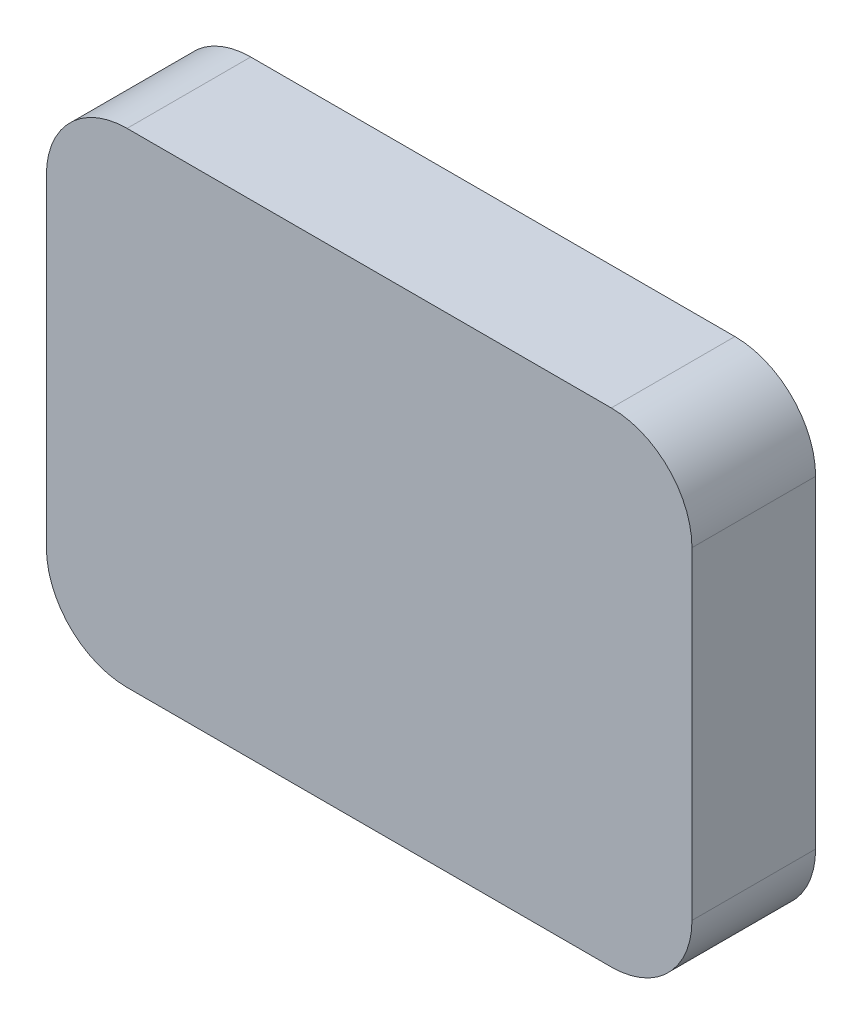
from build123d import *

# Parameters (mm, degrees)
BOSS_EXTRU_1_DEPTH = 1.2
CONG_1_R           = 2


with BuildPart() as part:
    # Balayage1: sweep along a path in Esquisse1
    with BuildLine(Plane.XY) as balayage1_path:
        Line((-30, 30), (30, 30))
        ThreePointArc((30, 30), (37.071067812, 27.071067812), (40, 20))
        Line((40, 20), (40, -20))
        ThreePointArc((40, -20), (37.071067812, -27.071067812), (30, -30))
        Line((30, -30), (-30, -30))
        ThreePointArc((-30, -30), (-37.071067812, -27.071067812), (-40, -20))
        Line((-40, -20), (-40, 20))
        ThreePointArc((-40, 20), (-37.071067812, 27.071067812), (-30, 30))
    # profil → Balayage1 (sweep)
    with BuildSketch(Plane(origin=(0, 0, 0), x_dir=(0, 0, -1), z_dir=(1, 0, 0))):
        with BuildLine():
            Line((0, -28.4), (4.139133187, -28.4))
            Line((4.139133187, -28.4), (14.1228, -23.8))
            Line((14.1228, -23.8), (14.1228, -25.4))
            ThreePointArc((14.1228, -25.4), (15.6228, -26.9), (14.1228, -28.4))
            Line((14.1228, -28.4), (14.1228, -30))
            Line((14.1228, -30), (0, -30))
            Line((0, -30), (0, -28.4))
        make_face()
    sweep(path=balayage1_path.line)

    # Esquisse1<3> → Boss.-Extru.1 (add)
    with BuildSketch(Plane.XY):
        with BuildLine():
            Line((-30, 30), (30, 30))
            ThreePointArc((30, 30), (37.071067812, 27.071067812), (40, 20))
            Line((40, 20), (40, -20))
            ThreePointArc((40, -20), (37.071067812, -27.071067812), (30, -30))
            Line((30, -30), (-30, -30))
            ThreePointArc((-30, -30), (-37.071067812, -27.071067812), (-40, -20))
            Line((-40, -20), (-40, 20))
            ThreePointArc((-40, 20), (-37.071067812, 27.071067812), (-30, 30))
        make_face()
    extrude(amount=BOSS_EXTRU_1_DEPTH)

    # Congé1
    cong_1_edges = [part.edges().sort_by_distance(p)[0] for p in [
        (-35.939696962, 25.939696962, 0),
        (-38.4, 0, 0),
        (-35.939696962, -25.939696962, 0),
        (0, -28.4, 0),
        (0, -28.4, 0),
        (35.939696962, -25.939696962, 0),
        (38.4, 0, 0),
        (35.939696962, 25.939696962, 0),
        (0, 28.4, 0),
    ]]
    fillet(cong_1_edges, radius=CONG_1_R)


solid = part.part
